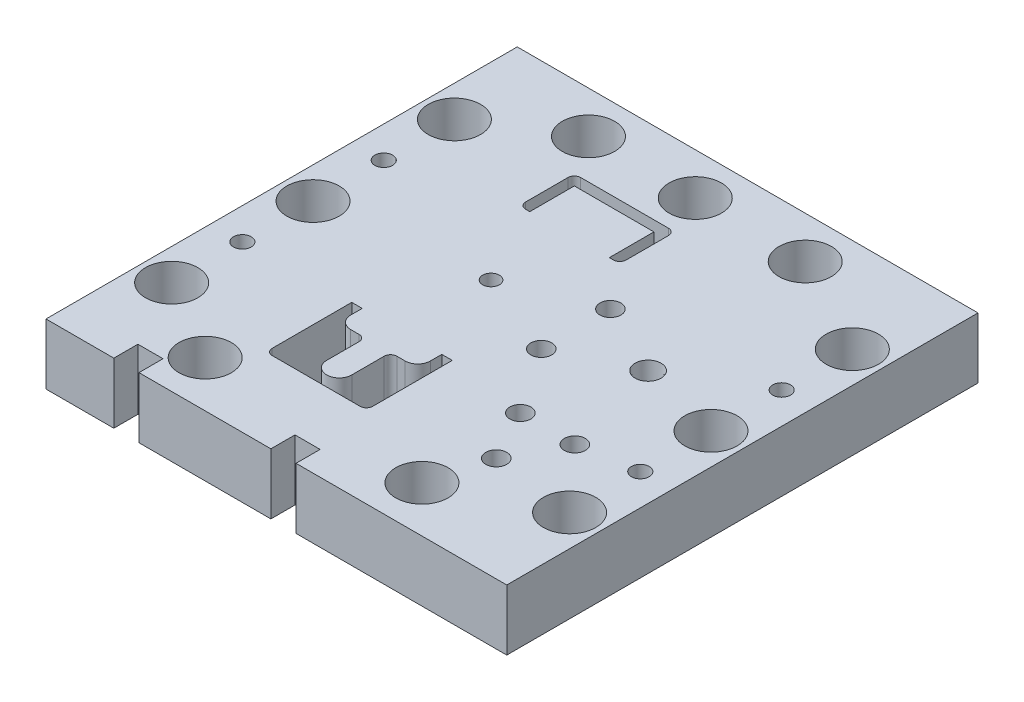
from build123d import *

# Parameters (mm, degrees)
SKETCH1_W                      = 220
SKETCH1_H                      = 225
BOSS_EXTRUDE1_DEPTH            = 29
CUT_EXTRUDE1_REACH             = 161.991
SKETCH2_R                      = 4
CUT_EXTRUDE2_REACH             = 161.991
SKETCH3_W                      = 12
SKETCH3_H                      = 11.5
LPATTERN1_COUNT                = 2
LPATTERN1_PITCH                = 75
SKETCH4_R                      = 8.5
CUT_EXTRUDE3_DEPTH             = 5
F_25_0_25_DIAMETER_HOLE3_D     = 25
F_25_0_25_DIAMETER_HOLE3_DEPTH = 20
F_25_0_25_DIAMETER_HOLE2_D     = 25
F_25_0_25_DIAMETER_HOLE2_DEPTH = 20
F_25_0_25_DIAMETER_HOLE1_D     = 25
F_25_0_25_DIAMETER_HOLE1_DEPTH = 20
CUT_EXTRUDE4_REACH             = 161.991
CUT_EXTRUDE6_REACH             = 161.991
F_10_0_10_DIAMETER_HOLE1_D     = 10
CUT_EXTRUDE7_REACH             = 161.991
SKETCH34_R                     = 5
M10_TAPPED_HOLE1_D             = 8.5


with BuildPart() as part:
    # Sketch1 → Boss-Extrude1 (new body)
    with BuildSketch(Plane(origin=(0, 0, 0), x_dir=(1, 0, 0), z_dir=(0, 1, 0))):
        Rectangle(SKETCH1_W, SKETCH1_H)
    extrude(amount=-BOSS_EXTRUDE1_DEPTH)

    # Sketch2 → Cut-Extrude1 (cut, up to next)
    with BuildSketch(Plane(origin=(0, 0, 0), x_dir=(1, 0, 0), z_dir=(0, 1, 0)), mode=Mode.PRIVATE) as cut_extrude1_sk1:
        with Locations((-19.87, 9.86)):
            Circle(SKETCH2_R)
    cut_extrude1_tool1 = extrude(cut_extrude1_sk1.sketch, amount=-CUT_EXTRUDE1_REACH, mode=Mode.PRIVATE) & part.part
    add(cut_extrude1_tool1.solids().sort_by_distance((-19.87, 0, -9.86))[0], mode=Mode.SUBTRACT)

    # Sketch3 → Cut-Extrude2 (cut, up to next)
    with BuildSketch(Plane.XZ.offset(29), mode=Mode.PRIVATE) as cut_extrude2_sk1:
        with Locations((3.38, 106.75)):
            Rectangle(SKETCH3_W, SKETCH3_H)
    cut_extrude2_tool1 = extrude(cut_extrude2_sk1.sketch, amount=-CUT_EXTRUDE2_REACH, mode=Mode.PRIVATE) & part.part
    cut_extrude2 = cut_extrude2_tool1.solids().sort_by_distance((3.38, -29, 106.75))[0]
    add(cut_extrude2, mode=Mode.SUBTRACT)

    # LPattern1: Cut-Extrude2 ×2
    with Locations(*[(-i * LPATTERN1_PITCH, 0, 0) for i in range(1, LPATTERN1_COUNT)]):
        add(cut_extrude2, mode=Mode.SUBTRACT)

    # Sketch4 → Cut-Extrude3 (cut)
    with BuildSketch(Plane.XZ.offset(29)):
        with Locations((-19.87, 100)):
            Circle(SKETCH4_R)
        with Locations((25, 100)):
            Circle(SKETCH4_R)
        with Locations((70, 100)):
            Circle(SKETCH4_R)
        with Locations((-19.87, -100)):
            Circle(SKETCH4_R)
        with Locations((25, -100)):
            Circle(SKETCH4_R)
        with Locations((70, -100)):
            Circle(SKETCH4_R)
        with Locations((-94.87, 100)):
            Circle(SKETCH4_R)
        with Locations((-94.87, -100)):
            Circle(SKETCH4_R)
    extrude(amount=-CUT_EXTRUDE3_DEPTH, mode=Mode.SUBTRACT)

    # Ø25.0 (25) Diameter Hole3
    with Locations(Plane(origin=(0, 0, 0), x_dir=(1, 0, 0), z_dir=(0, 1, 0))):
        with Locations((-95, -67.5), (-95, 0), (-95, 67.5), (95, 67.5), (95, 0), (95, -67.5)):
            Hole(F_25_0_25_DIAMETER_HOLE3_D / 2, depth=F_25_0_25_DIAMETER_HOLE3_DEPTH)

    # Ø25.0 (25) Diameter Hole2
    with Locations(Plane(origin=(0, 0, 0), x_dir=(1, 0, 0), z_dir=(0, 1, 0))):
        with Locations((-56, 92.5), (-5, 92.5), (47.5, 92.5)):
            Hole(F_25_0_25_DIAMETER_HOLE2_D / 2, depth=F_25_0_25_DIAMETER_HOLE2_DEPTH)

    # Ø25.0 (25) Diameter Hole1
    with Locations(Plane(origin=(0, 0, 0), x_dir=(1, 0, 0), z_dir=(0, 1, 0))):
        with Locations((47.5, -90.5), (-56, -90.5)):
            Hole(F_25_0_25_DIAMETER_HOLE1_D / 2, depth=F_25_0_25_DIAMETER_HOLE1_DEPTH)

    # Sketch24 → Cut-Extrude4 (cut, up to next)
    with BuildSketch(Plane(origin=(0, 0, 0), x_dir=(1, 0, 0), z_dir=(0, 1, 0)), mode=Mode.PRIVATE) as cut_extrude4_sk1:
        with BuildLine():
            Line((4.13, -32.64), (-0.87, -32.64))
            Line((-0.87, -32.64), (-0.87, -38.14))
            ThreePointArc((-0.87, -38.14), (-2.627359313, -42.382640687), (-6.87, -44.14))
            Line((-6.87, -44.14), (-10.87, -44.14))
            ThreePointArc((-10.87, -44.14), (-12.991320344, -45.018679656), (-13.87, -47.14))
            Line((-13.87, -47.14), (-13.87, -62.64))
            ThreePointArc((-13.87, -62.64), (-19.87, -68.64), (-25.87, -62.64))
            Line((-25.87, -62.64), (-25.87, -47.14))
            ThreePointArc((-25.87, -47.14), (-26.748679656, -45.018679656), (-28.87, -44.14))
            Line((-28.87, -44.14), (-32.87, -44.14))
            ThreePointArc((-32.87, -44.14), (-37.112640687, -42.382640687), (-38.87, -38.14))
            Line((-38.87, -38.14), (-38.87, -32.64))
            Line((-38.87, -32.64), (-43.87, -32.64))
            Line((-43.87, -32.64), (-43.87, -70.64))
            ThreePointArc((-43.87, -70.64), (-42.991320344, -72.761320344), (-40.87, -73.64))
            Line((-40.87, -73.64), (1.13, -73.64))
            ThreePointArc((1.13, -73.64), (3.251320344, -72.761320344), (4.13, -70.64))
            Line((4.13, -70.64), (4.13, -32.64))
        make_face()
    cut_extrude4_tool1 = extrude(cut_extrude4_sk1.sketch, amount=-CUT_EXTRUDE4_REACH, mode=Mode.PRIVATE) & part.part
    add(cut_extrude4_tool1.solids().sort_by_distance((-42.544946, 0, 72.314946))[0], mode=Mode.SUBTRACT)

    # Sketch29 → Cut-Extrude6 (cut, up to next)
    with BuildSketch(Plane.XZ.offset(29), mode=Mode.PRIVATE) as cut_extrude6_sk1:
        with BuildLine():
            Line((-0.87, -47.36), (1.13, -47.36))
            ThreePointArc((1.13, -47.36), (3.251320344, -48.238679656), (4.13, -50.36))
            Line((4.13, -50.36), (4.13, -70.64))
            ThreePointArc((4.13, -70.64), (3.251320344, -72.761320344), (1.13, -73.64))
            Line((1.13, -73.64), (-40.87, -73.64))
            ThreePointArc((-40.87, -73.64), (-42.991320344, -72.761320344), (-43.87, -70.64))
            Line((-43.87, -70.64), (-43.87, -50.36))
            ThreePointArc((-43.87, -50.36), (-42.991320344, -48.238679656), (-40.87, -47.36))
            Line((-40.87, -47.36), (-38.87, -47.36))
            Line((-38.87, -47.36), (-38.87, -68.64))
            Line((-38.87, -68.64), (-0.87, -68.64))
            Line((-0.87, -68.64), (-0.87, -47.36))
        make_face()
    cut_extrude6_tool1 = extrude(cut_extrude6_sk1.sketch, amount=-CUT_EXTRUDE6_REACH, mode=Mode.PRIVATE) & part.part
    add(cut_extrude6_tool1.solids().sort_by_distance((0.13, -29, -47.907233))[0], mode=Mode.SUBTRACT)

    # Ø10.0 (10) Diameter Hole1 (through all)
    with Locations(Plane(origin=(0, 0, 0), x_dir=(1, 0, 0), z_dir=(0, 1, 0))):
        with Locations((55.13, -62.64), (68.13, -38.14), (42.13, -38.14), (20.63, 26.36), (20.63, -6.64)):
            Hole(F_10_0_10_DIAMETER_HOLE1_D / 2)

    # Sketch34 → Cut-Extrude7 (cut, up to next)
    with BuildSketch(Plane(origin=(0, 0, 0), x_dir=(1, 0, 0), z_dir=(0, 1, 0)), mode=Mode.PRIVATE) as cut_extrude7_sk1:
        with Locations((55.13, 9.86)):
            Circle(SKETCH34_R)
    cut_extrude7_tool1 = extrude(cut_extrude7_sk1.sketch, amount=-CUT_EXTRUDE7_REACH, mode=Mode.PRIVATE) & part.part
    add(cut_extrude7_tool1.solids().sort_by_distance((55.13, 0, -9.86))[0], mode=Mode.SUBTRACT)

    # Cut-Sweep1: sweep along a curve in space
    with BuildLine() as cut_sweep1_path:
        ThreePointArc((55.13, 0, -4.86), (58.665533906, 0, -6.324466094), (60.13, 0, -9.86))
        ThreePointArc((60.13, 0, -9.86), (58.665533906, 0, -13.395533906), (55.13, 0, -14.86))
        ThreePointArc((55.13, 0, -14.86), (51.594466094, 0, -13.395533906), (50.13, 0, -9.86))
        ThreePointArc((50.13, 0, -9.86), (51.594466094, 0, -6.324466094), (55.13, 0, -4.86))
    # Sketch35 → Cut-Sweep1 (sweep, cut)
    with BuildSketch(Plane.XY.offset(-9.86)):
        Polygon((60.13, -23), (61.335378924, 0), (60.13, 0), align=None)
    sweep(path=cut_sweep1_path.line, mode=Mode.SUBTRACT)

    # M10 Tapped Hole1 (through all)
    with Locations(Plane(origin=(0, 0, 0), x_dir=(1, 0, 0), z_dir=(0, 1, 0))):
        with Locations((-95, 33.75), (-95, -33.75), (95, -33.75), (95, 33.75)):
            Hole(M10_TAPPED_HOLE1_D / 2)


solid = part.part
